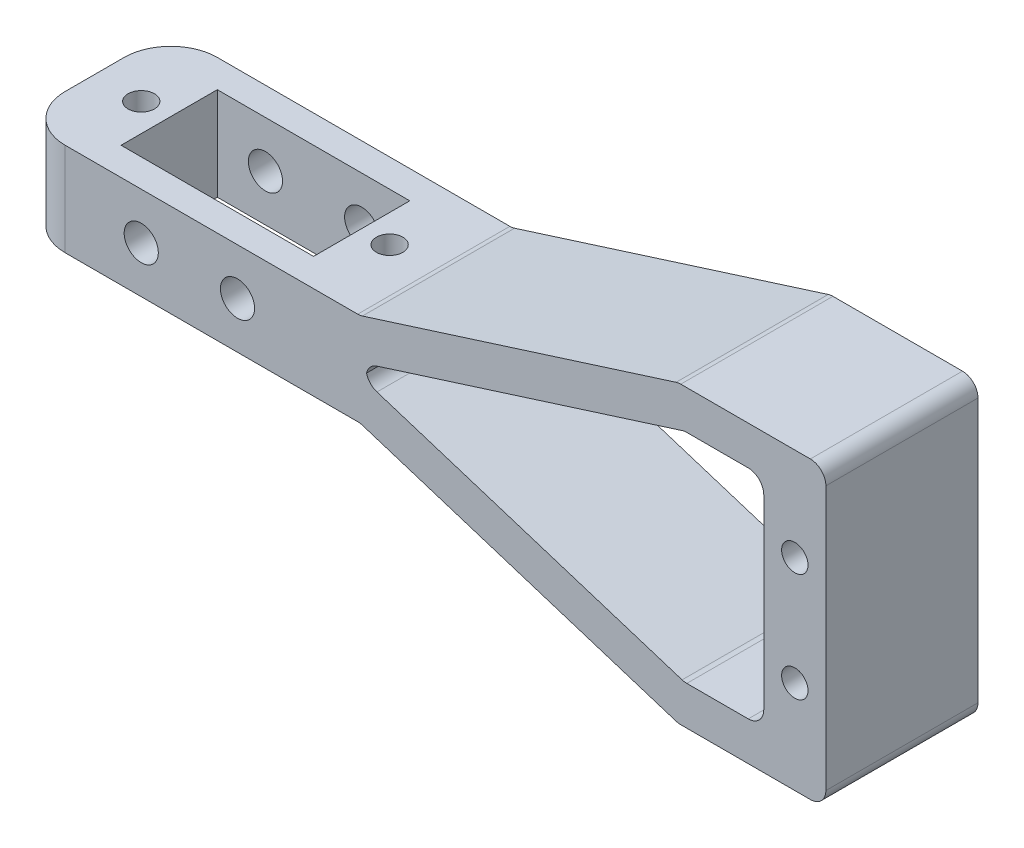
from build123d import *

# Parameters (mm, degrees)
SKETCH_1_R          = 2.2
SKETCH_1_R_2        = 1.7
EXTRUDE_1_DEPTH     = 19.6
SKETCH_2_R          = 1.7
SKETCH_2_W          = 24.8
SKETCH_2_H          = 12.4
CUT_EXTRUDE_1_DEPTH = 88.938387522
CUT_EXTRUDE_2_DEPTH = 87.424302138
FILLET_1_R          = 2
FILLET_2_R          = 6


with BuildPart() as part:
    # 草图1 → 凸台-拉伸1 (new body)
    with BuildSketch(Plane.XY):
        Polygon((-22, -6), (22, -6), (63, -19), (82, -19), (82, 19), (63, 19), (22, 6), (-22, 6), align=None)
        with Locations((-6.2, 0)):
            Circle(SKETCH_1_R, mode=Mode.SUBTRACT)
        with Locations((6.2, 0)):
            Circle(SKETCH_1_R, mode=Mode.SUBTRACT)
        with Locations((78, 7)):
            Circle(SKETCH_1_R_2, mode=Mode.SUBTRACT)
        with Locations((78, -7)):
            Circle(SKETCH_1_R_2, mode=Mode.SUBTRACT)
    extrude(amount=EXTRUDE_1_DEPTH)

    # 草图2 → 切除-拉伸1 (cut, through all)
    with BuildSketch(Plane(origin=(0, 6, 0), x_dir=(1, 0, 0), z_dir=(0, 1, 0))):
        with Locations(Location((16, -9.8, 0), (0, 0, 270))):
            Circle(SKETCH_2_R)
        with Locations(Location((-16, -9.8, 0), (0, 0, 270))):
            Circle(SKETCH_2_R)
        with Locations((0, -9.8)):
            Rectangle(SKETCH_2_W, SKETCH_2_H)
    extrude(amount=-CUT_EXTRUDE_1_DEPTH, mode=Mode.SUBTRACT)

    # 草图3 → 切除-拉伸2 (cut, through all)
    with BuildSketch(Plane.XY.offset(19.6)):
        Polygon((74, 14), (74, -14), (63.773702437, -14), (22.773702437, -1), (22.773702437, 1), (63.773702437, 14), align=None)
    extrude(amount=-CUT_EXTRUDE_2_DEPTH, mode=Mode.SUBTRACT)

    # 圆角1
    # the kernel refuses this fillet: 2 mm, written as the material it adds along each edge
    with BuildSketch(Plane(origin=(74, 14, 19.6), x_dir=(-1, 0, 0), z_dir=(0, 0, -1))) as fillet_1_piece_1:
        with BuildLine():
            CenterArc((FILLET_1_R, -FILLET_1_R), FILLET_1_R, 90, 90)
            Line((0, -FILLET_1_R), (0, 0))
            Line((0, 0), (FILLET_1_R, 0))
        make_face()
    extrude(amount=19.6)
    with BuildSketch(Plane(origin=(63.773702437, 14, 19.6), x_dir=(1, 0, 0), z_dir=(0, 0, -1)), Plane(origin=(63.773702437, -14, 19.6), x_dir=(-0.9532306376993169, 0.30224386073393383, 0), z_dir=(0, 0, -1)), Plane(origin=(22, -6, 0), x_dir=(-1, 0, 0), z_dir=(0, 0, 1))) as fillet_1_piece_2:
        with BuildLine():
            CenterArc((FILLET_1_R * 0.154740487324, FILLET_1_R), FILLET_1_R, 252.407575438, 17.592424562)
            Line((-FILLET_1_R * 0.14750337341, FILLET_1_R * 0.0467693623007), (0, 0))
            Line((0, 0), (FILLET_1_R * 0.154740487324, 0))
        make_face()
    extrude(amount=19.6)
    with BuildSketch(Plane(origin=(74, -14, 19.6), x_dir=(-1, 0, 0), z_dir=(0, 0, -1))) as fillet_1_piece_3:
        with BuildLine():
            CenterArc((FILLET_1_R, FILLET_1_R), FILLET_1_R, 180, 90)
            Line((0, FILLET_1_R), (0, 0))
            Line((0, 0), (FILLET_1_R, 0))
        make_face()
    extrude(amount=19.6)
    with BuildSketch(Plane(origin=(22.773702437, 1, 19.6), x_dir=(0.9532306376993182, 0.30224386073392995, 0), z_dir=(0, 0, -1)), Plane(origin=(22.773702437, -1, 19.6), x_dir=(0, 1, 0), z_dir=(0, 0, -1))) as fillet_1_piece_4:
        with BuildLine():
            CenterArc((FILLET_1_R * 0.731990886225, FILLET_1_R), FILLET_1_R, 197.592424562, 72.407575438)
            Line((-FILLET_1_R * 0.221239751475, FILLET_1_R * 0.697756139266), (0, 0))
            Line((0, 0), (FILLET_1_R * 0.731990886225, 0))
        make_face()
    extrude(amount=19.6)
    with BuildSketch(Plane(origin=(22, 6, 0), x_dir=(-1, 0, 0), z_dir=(0, 0, 1))) as fillet_1_piece_5:
        with BuildLine():
            CenterArc((FILLET_1_R * 0.154740487324, -FILLET_1_R), FILLET_1_R, 90, 17.592424562)
            Line((-FILLET_1_R * 0.14750337341, -FILLET_1_R * 0.0467693623007), (0, 0))
            Line((0, 0), (FILLET_1_R * 0.154740487324, 0))
        make_face()
    extrude(amount=19.6)
    # the kernel refuses this fillet: 2 mm, written as the material it takes off along each edge
    with BuildSketch(Plane(origin=(82, -19, -5), x_dir=(-1, 0, 0), z_dir=(0, 0, 1)), Plane(origin=(82, 19, -5), x_dir=(0, -1, 0), z_dir=(0, 0, 1))) as fillet_1_2_piece_1:
        with BuildLine():
            CenterArc((FILLET_1_R, -FILLET_1_R), FILLET_1_R, 90, 90)
            Line((0, -FILLET_1_R), (0, 0))
            Line((0, 0), (FILLET_1_R, 0))
        make_face()
    extrude(amount=29.6, mode=Mode.SUBTRACT)
    with BuildSketch(Plane(origin=(63, -19, -0.773702437), x_dir=(-0.9532306376993186, 0.3022438607339286, 0), z_dir=(0, 0, 1))) as fillet_1_2_piece_2:
        with BuildLine():
            CenterArc((FILLET_1_R * 0.154740487324, -FILLET_1_R), FILLET_1_R, 90, 17.592424562)
            Line((-FILLET_1_R * 0.14750337341, -FILLET_1_R * 0.0467693623007), (0, 0))
            Line((0, 0), (FILLET_1_R * 0.154740487324, 0))
        make_face()
    extrude(amount=21.147404873, mode=Mode.SUBTRACT)
    with BuildSketch(Plane(origin=(63, 19, -0.773702437), x_dir=(-0.9532306376993186, -0.3022438607339286, 0), z_dir=(0, 0, 1))) as fillet_1_2_piece_3:
        with BuildLine():
            CenterArc((FILLET_1_R * 0.154740487324, FILLET_1_R), FILLET_1_R, 252.407575438, 17.592424562)
            Line((-FILLET_1_R * 0.14750337341, FILLET_1_R * 0.0467693623007), (0, 0))
            Line((0, 0), (FILLET_1_R * 0.154740487324, 0))
        make_face()
    extrude(amount=21.147404873, mode=Mode.SUBTRACT)

    # 圆角2
    fillet_2_edges = [part.edges().sort_by_distance(p)[0] for p in [
        (-22, 0, 0),
        (-22, 0, 19.6),
    ]]
    fillet(fillet_2_edges, radius=FILLET_2_R)


solid = part.part
